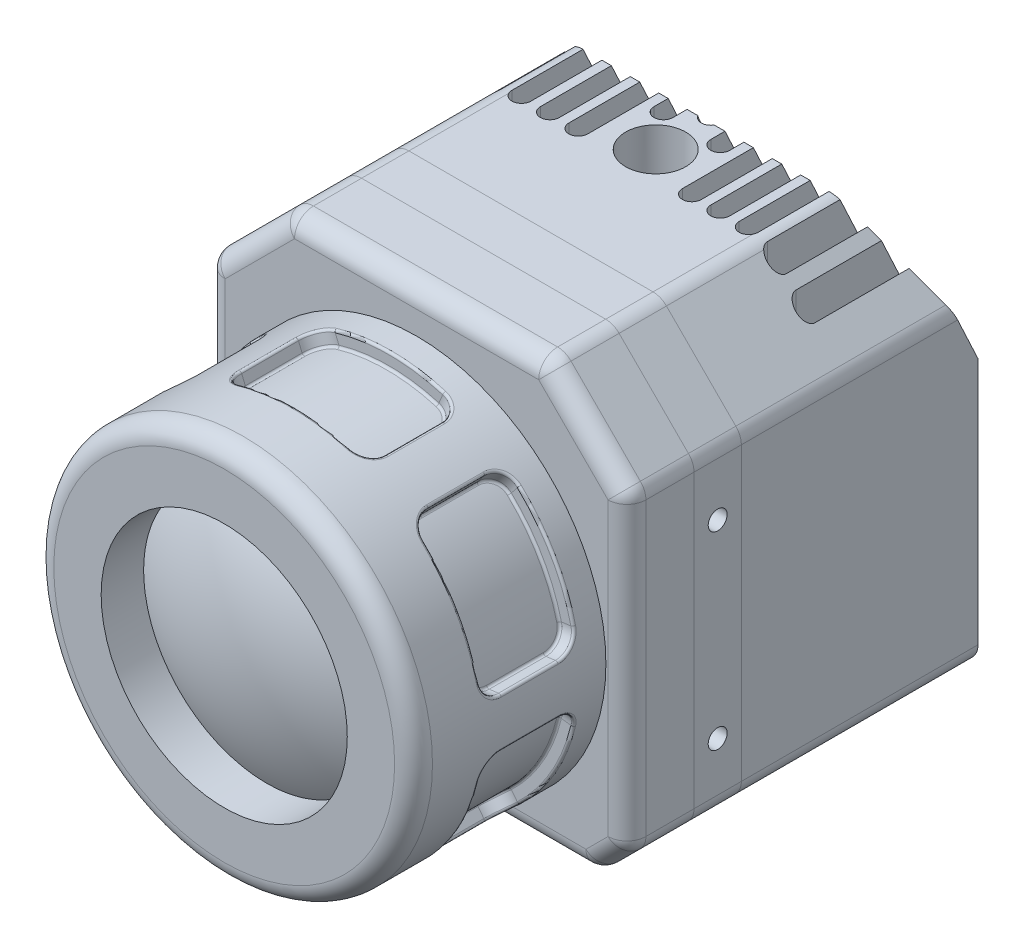
from build123d import *
from build123d.topology import SkipClean

# Parameters (mm, degrees)
BOSS_EXTRUDE1_DEPTH      = 25
BOSS_EXTRUDE2_START      = 37.084
BOSS_EXTRUDE2_DEPTH      = 20.32
BOSS_EXTRUDE3_START      = 25
BOSS_EXTRUDE3_DEPTH      = 5
BOSS_EXTRUDE4_START      = 30
BOSS_EXTRUDE4_DEPTH      = 7.08
CUT_EXTRUDE2_DEPTH       = 66.539452553
CUT_EXTRUDE5_START       = -20
SKETCH9_R                = 1
CUT_EXTRUDE5_DEPTH       = 46.539452553
FILLET1_R                = 2
FILLET3_R                = 2
FILLET7_R                = 2
FILLET8_R                = 2
SHELL4_T                 = -6.3
SHELL5_START             = 32
SHELL5_DEPTH             = 3.08
CUT_EXTRUDE4_DEPTH       = 66.539452641
CUT_EXTRUDE4_DEPTH_BACK  = 66.539452641
FILLET4_R                = 2
SKETCH7_W                = 10
SKETCH7_H                = 1.5
CUT_REVOLVE5_ANGLE       = 45
FILLET5_R                = 2
FILLET6_R                = 0.25
CIRPATTERN1_COUNT        = 6
FILLET5_OF_CIRPATTERN1_R = 2
FILLET6_OF_CIRPATTERN1_R = 0.25
SKETCH11_R               = 1
CUT_EXTRUDE6_DEPTH       = 4


# Read off the part's stored shape, not the designer's step: Shell5
with BuildPart() as part:
    # Sketch2 → Boss-Extrude1 (new body)
    with BuildSketch(Plane.XY):
        Polygon((0, 21.95), (-13.725, 21.95), (-22.225, 13.45), (-22.225, -19), (-18.725, -22.5), (0, -22.5), align=None)
    extrude(amount=BOSS_EXTRUDE1_DEPTH)

    # Sketch5 → Cut-Extrude2 (cut, through all)
    with BuildSketch(Plane(origin=(0, 0, 0), x_dir=(0, 0, -1), z_dir=(1, 0, 0))):
        Polygon((-6.504991831, 21.95), (0, 8), (0, 21.95), align=None)
    extrude(amount=-CUT_EXTRUDE2_DEPTH, mode=Mode.SUBTRACT)

    # Fillet3
    fillet3_edges = [part.edges().sort_by_distance(p)[0] for p in [
        (-18.725, -22.5, 12.5),
        (-22.225, -19, 12.5),
        (-22.225, 13.45, 13.770688368),
        (-13.725, 21.95, 15.752495916),
    ]]
    fillet(fillet3_edges, radius=FILLET3_R)

    # Shell4
    shell4_openings = [part.faces().sort_by_distance(p)[0] for p in [
        (0, -1.023133208, 12.93979886),
    ]]
    offset(amount=SHELL4_T, openings=shell4_openings, kind=Kind.INTERSECTION)

    # Sketch6 → Cut-Extrude4 (cut, two sides: drawn at the far end of the back side and taken through both)
    with BuildSketch(Plane(origin=(0, 0, 0), x_dir=(1, 0, 0), z_dir=(0, 1, 0)).offset(-CUT_EXTRUDE4_DEPTH_BACK)):
        with BuildLine():
            Line((0, -7), (0, 10))
            ThreePointArc((0, 10), (-0.707106781, 9.707106781), (-1, 9))
            Line((-1, 9), (-1, -6))
            ThreePointArc((-1, -6), (-0.707106781, -6.707106781), (0, -7))
        make_face()
        with BuildLine():
            Line((-4, -8), (-4, 9))
            ThreePointArc((-4, 9), (-3, 10), (-2, 9))
            Line((-2, 9), (-2, -8))
            ThreePointArc((-2, -8), (-3, -9), (-4, -8))
        make_face()
        with BuildLine():
            Line((-7, -14), (-7, 9))
            ThreePointArc((-7, 9), (-6, 10), (-5, 9))
            Line((-5, 9), (-5, -14))
            ThreePointArc((-5, -14), (-6, -15), (-7, -14))
        make_face()
        with BuildLine():
            Line((-10, -14), (-10, 9))
            ThreePointArc((-10, 9), (-9, 10), (-8, 9))
            Line((-8, 9), (-8, -14))
            ThreePointArc((-8, -14), (-9, -15), (-10, -14))
        make_face()
        with BuildLine():
            Line((-13, -14), (-13, 9))
            ThreePointArc((-13, 9), (-12, 10), (-11, 9))
            Line((-11, 9), (-11, -14))
            ThreePointArc((-11, -14), (-12, -15), (-13, -14))
        make_face()
        with BuildLine():
            Line((-16, -14), (-16, 9))
            ThreePointArc((-16, 9), (-15, 10), (-14, 9))
            Line((-14, 9), (-14, -14))
            ThreePointArc((-14, -14), (-15, -15), (-16, -14))
        make_face()
        with BuildLine():
            Line((-19, -14), (-19, 9))
            ThreePointArc((-19, 9), (-18, 10), (-17, 9))
            Line((-17, 9), (-17, -14))
            ThreePointArc((-17, -14), (-18, -15), (-19, -14))
        make_face()
        with BuildLine():
            Line((0, -15), (0, -8.65))
            ThreePointArc((0, -8.65), (-3.175, -11.825), (0, -15))
        make_face()
    extrude(amount=CUT_EXTRUDE4_DEPTH + CUT_EXTRUDE4_DEPTH_BACK, mode=Mode.SUBTRACT)

    # Mirror1: part across plane


with BuildPart() as body_2:
    # Sketch2<3> → Boss-Extrude2 (new body)
    with BuildSketch(Plane.XY.offset(BOSS_EXTRUDE2_START)):
        with BuildLine():
            Line((0, 10.5), (0, 17.5))
            ThreePointArc((0, 17.5), (-20, -2.5), (0, -22.5))
            Line((0, -22.5), (0, -15.5))
            ThreePointArc((0, -15.5), (-13, -2.5), (0, 10.5))
        make_face()
    extrude(amount=BOSS_EXTRUDE2_DEPTH)

    # Fillet1
    fillet1_edges = [body_2.edges().sort_by_distance(p)[0] for p in [
        (-20, -2.5, 57.404),
    ]]
    fillet(fillet1_edges, radius=FILLET1_R)

    # Mirror1 4: body 2 across plane


with BuildPart() as body_3:
    # Sketch2<4> → Boss-Extrude3 (new body)
    with BuildSketch(Plane.XY.offset(BOSS_EXTRUDE3_START)):
        Polygon((0, 21.95), (-13.725, 21.95), (-22.225, 13.45), (-22.225, -19), (-18.725, -22.5), (0, -22.5), align=None)
    extrude(amount=BOSS_EXTRUDE3_DEPTH)

    # Sketch9 → Cut-Extrude5 (cut, through all)
    with BuildSketch(Plane(origin=(0, 0, 0), x_dir=(0, 0, -1), z_dir=(1, 0, 0)).offset(CUT_EXTRUDE5_START)):
        with Locations((-27.5, 7)):
            Circle(SKETCH9_R)
        with Locations((-27.5, -13)):
            Circle(SKETCH9_R)
    extrude(amount=-CUT_EXTRUDE5_DEPTH, mode=Mode.SUBTRACT)

    # Fillet7
    fillet7_edges = [body_3.edges().sort_by_distance(p)[0] for p in [
        (-18.725, -22.5, 27.5),
        (-22.225, -19, 27.5),
        (-22.225, 13.45, 27.5),
        (-13.725, 21.95, 27.5),
    ]]
    fillet(fillet7_edges, radius=FILLET7_R)

    # Mirror1 2: body 3 across plane


with BuildPart() as body_4:
    # Sketch2<5> → Boss-Extrude4 (new body)
    with BuildSketch(Plane.XY.offset(BOSS_EXTRUDE4_START)):
        Polygon((0, 21.95), (-13.725, 21.95), (-22.225, 13.45), (-22.225, -19), (-18.725, -22.5), (0, -22.5), align=None)
    extrude(amount=BOSS_EXTRUDE4_DEPTH)

    # Fillet8
    fillet8_edges = [body_4.edges().sort_by_distance(p)[0] for p in [
        (-18.725, -22.5, 33.54),
        (-22.225, -19, 33.54),
        (-22.225, 13.45, 33.54),
        (-13.725, 21.95, 33.54),
    ]]
    fillet(fillet8_edges, radius=FILLET8_R)

    # Shell5 outline → Shell5 (cut)
    with BuildSketch(Plane.XY.offset(SHELL5_START)):
        Polygon((-20.225, -18.171572875), (-17.896572875, -20.5), (0, -20.5), (0, 19.95), (-12.896572875, 19.95), (-20.225, 12.621572875), align=None)
    extrude(amount=SHELL5_DEPTH, mode=Mode.SUBTRACT)

    # Mirror1 3: body 4 across plane


with BuildPart() as part_1:
    add(part.part)
    add(part.part.mirror(Plane(origin=(0, 0, 0), x_dir=(0, 0, 1), z_dir=(1, 0, 0))))


with BuildPart() as body_3_1:
    add(body_3.part)
    add(body_3.part.mirror(Plane(origin=(0, 0, 0), x_dir=(0, 0, 1), z_dir=(1, 0, 0))))

    # Sketch11 → Cut-Extrude6 (cut)
    with BuildSketch(Plane.XZ.offset(22.5)):
        with Locations((-15, 27.5)):
            Circle(SKETCH11_R)
        with Locations((15, 27.5)):
            Circle(SKETCH11_R)
    extrude(amount=-CUT_EXTRUDE6_DEPTH, mode=Mode.SUBTRACT)


with BuildPart() as body_4_1:
    add(body_4.part)
    add(body_4.part.mirror(Plane(origin=(0, 0, 0), x_dir=(0, 0, 1), z_dir=(1, 0, 0))))

    # Fillet4
    fillet4_edges = [body_4_1.edges().sort_by_distance(p)[0] for p in [
        (-20.475, -20.75, 37.08),
        (0, 21.95, 37.08),
        (-17.975, 17.7, 37.08),
        (-22.225, -2.775, 37.08),
        (-13.66193974, 21.797759065, 37.08),
        (-22.072759065, 13.38693974, 37.08),
        (-22.072759065, -18.93693974, 37.08),
        (-18.66193974, -22.347759065, 37.08),
        (0, -22.5, 37.08),
        (20.475, -20.75, 37.08),
        (22.225, -2.775, 37.08),
        (17.975, 17.7, 37.08),
        (18.66193974, -22.347759065, 37.08),
        (22.072759065, -18.93693974, 37.08),
        (22.072759065, 13.38693974, 37.08),
        (13.66193974, 21.797759065, 37.08),
    ]]
    fillet(fillet4_edges, radius=FILLET4_R)


with BuildPart() as body_2_1:
    with SkipClean():  # the faces are left unmerged after this step: merging them gives an invalid solid
        add(body_2.part)
        add(body_2.part.mirror(Plane(origin=(0, 0, 0), x_dir=(0, 0, 1), z_dir=(1, 0, 0))))

    # Sketch7 → Cut-Revolve5 (revolve, symmetric, cut)
    with SkipClean():  # the faces are left unmerged after this step: merging them gives an invalid solid
        with BuildSketch(Plane(origin=(0, 0, 0), x_dir=(0, 0, -1), z_dir=(1, 0, 0))) as cut_revolve5_sk:
            with Locations((-45, 16.75)):
                Rectangle(SKETCH7_W, SKETCH7_H)
        cut_revolve5 = revolve(axis=Axis((0, -2.5, 57.404), (0, 0, -1)), revolution_arc=CUT_REVOLVE5_ANGLE / 2, mode=Mode.SUBTRACT)
        cut_revolve5 = cut_revolve5 + revolve(cut_revolve5_sk.sketch, axis=Axis((0, -2.5, 57.404), (0, 0, 1)), revolution_arc=CUT_REVOLVE5_ANGLE / 2, mode=Mode.SUBTRACT)

    # Fillet5
    fillet5_edges = [body_2_1.edges().sort_by_distance(p)[0] for p in [
        (-7.366656073, 15.284681001, 50),
        (-7.366656073, 15.284681001, 40),
        (7.366656073, 15.284681001, 50),
        (7.366656073, 15.284681001, 40),
    ]]
    fillet(fillet5_edges, radius=FILLET5_R)

    # Fillet6
    fillet6_edges = [body_2_1.edges().sort_by_distance(p)[0] for p in [
        (-7.079643499, 14.591771351, 45),
        (-7.653668647, 15.97759065, 45),
        (0, 16, 40),
        (0, 16, 50),
        (7.079643499, 14.591771351, 45),
        (6.533711816, 14.807819328, 40.58452092),
        (6.533711816, 14.807819328, 49.41547908),
        (-6.53371182, 14.807819327, 40.58452092),
        (-6.533711816, 14.807819328, 49.41547908),
        (2.914897203, 17.286444205, 50),
        (-2.914897203, 17.286444205, 40),
        (7.653668647, 15.97759065, 45),
        (-7.108176358, 16.194219129, 49.415295587),
        (-7.108176358, 16.19421913, 40.584704412),
        (7.108176358, 16.194219129, 49.415295587),
        (7.108176358, 16.194219129, 40.584704413),
    ]]
    fillet(fillet6_edges, radius=FILLET6_R)

    # CirPattern1: Cut-Revolve5 ×6 about axis
    with SkipClean():  # the faces are left unmerged after this step: merging them gives an invalid solid
        cirpattern1_axis = Axis((0, -2.5, 57.404), (0, 0, -1))
        for i in range(1, CIRPATTERN1_COUNT):
            add(cut_revolve5.rotate(cirpattern1_axis, i * 360 / CIRPATTERN1_COUNT), mode=Mode.SUBTRACT)

    # Fillet5 of CirPattern1
    fillet5_of_cirpattern1_edges = [body_2_1.edges().sort_by_distance(p)[0] for p in [
        (11.718657508, 12.772051801, 50),
        (11.718657508, 12.772051801, 40),
        (19.085313581, 0.0126292, 50),
        (19.085313581, 0.0126292, 40),
        (19.085313581, -5.0126292, 50),
        (19.085313581, -5.0126292, 40),
        (11.718657508, -17.772051801, 50),
        (11.718657508, -17.772051801, 40),
        (7.366656073, -20.284681001, 50),
        (7.366656073, -20.284681001, 40),
        (-7.366656073, -20.284681001, 50),
        (-7.366656073, -20.284681001, 40),
        (-11.718657508, -17.772051801, 50),
        (-11.718657508, -17.772051801, 40),
        (-19.085313581, -5.0126292, 50),
        (-19.085313581, -5.0126292, 40),
        (-19.085313581, 0.0126292, 50),
        (-19.085313581, 0.0126292, 40),
        (-11.718657508, 12.772051801, 50),
        (-11.718657508, 12.772051801, 40),
    ]]
    fillet(fillet5_of_cirpattern1_edges, radius=FILLET5_OF_CIRPATTERN1_R)

    # Fillet6 of CirPattern1
    fillet6_of_cirpattern1_edges = [body_2_1.edges().sort_by_distance(p)[0] for p in [
        (11.262086437, 12.177036795, 45),
        (12.17522858, 13.367066806, 45),
        (16.02146997, 6.75, 40),
        (16.02146997, 6.75, 50),
        (18.341729935, -0.085265444, 45),
        (18.255867131, 0.49554925, 40.58452092),
        (18.255867131, 0.49554925, 49.41547908),
        (11.722155312, 11.812270081, 40.58452092),
        (11.722155314, 11.812270078, 49.41547908),
        (18.593011934, 4.868847076, 50),
        (15.678114731, 9.91759713, 40),
        (19.828897227, 0.110523844, 45),
        (12.635580491, 13.002970866, 49.415295587),
        (12.635580491, 13.002970865, 40.584704412),
        (19.743756849, 0.691248264, 49.415295587),
        (19.743756849, 0.691248264, 40.584704413),
        (18.341729935, -4.914734556, 45),
        (19.828897227, -5.110523844, 45),
        (16.02146997, -11.75, 40),
        (16.02146997, -11.75, 50),
        (11.262086437, -17.177036795, 45),
        (11.722155314, -16.812270078, 40.58452092),
        (11.722155314, -16.812270078, 49.41547908),
        (18.255867131, -5.495549247, 40.58452092),
        (18.255867131, -5.49554925, 49.41547908),
        (15.678114731, -14.91759713, 50),
        (18.593011934, -9.868847076, 40),
        (12.17522858, -18.367066806, 45),
        (19.743756849, -5.691248264, 49.415295587),
        (19.743756849, -5.691248264, 40.584704412),
        (12.635580491, -18.002970866, 49.415295587),
        (12.635580491, -18.002970866, 40.584704413),
        (7.079643499, -19.591771351, 45),
        (7.653668647, -20.97759065, 45),
        (0, -21, 40),
        (0, -21, 50),
        (-7.079643499, -19.591771351, 45),
        (-6.533711816, -19.807819328, 40.58452092),
        (-6.533711816, -19.807819328, 49.41547908),
        (6.53371182, -19.807819327, 40.58452092),
        (6.533711816, -19.807819328, 49.41547908),
        (-2.914897203, -22.286444205, 50),
        (2.914897203, -22.286444205, 40),
        (-7.653668647, -20.97759065, 45),
        (7.108176358, -21.194219129, 49.415295587),
        (7.108176358, -21.19421913, 40.584704412),
        (-7.108176358, -21.194219129, 49.415295587),
        (-7.108176358, -21.194219129, 40.584704413),
        (-11.262086437, -17.177036795, 45),
        (-12.17522858, -18.367066806, 45),
        (-16.02146997, -11.75, 40),
        (-16.02146997, -11.75, 50),
        (-18.341729935, -4.914734556, 45),
        (-18.255867131, -5.49554925, 40.58452092),
        (-18.255867131, -5.49554925, 49.41547908),
        (-11.722155312, -16.812270081, 40.58452092),
        (-11.722155314, -16.812270078, 49.41547908),
        (-18.593011934, -9.868847076, 50),
        (-15.678114731, -14.91759713, 40),
        (-19.828897227, -5.110523844, 45),
        (-12.635580491, -18.002970866, 49.415295587),
        (-12.635580491, -18.002970865, 40.584704412),
        (-19.743756849, -5.691248264, 49.415295587),
        (-19.743756849, -5.691248264, 40.584704413),
        (-18.341729935, -0.085265444, 45),
        (-19.828897227, 0.110523844, 45),
        (-16.02146997, 6.75, 40),
        (-16.02146997, 6.75, 50),
        (-11.262086437, 12.177036795, 45),
        (-11.722155314, 11.812270078, 40.58452092),
        (-11.722155314, 11.812270078, 49.41547908),
        (-18.255867131, 0.495549247, 40.58452092),
        (-18.255867131, 0.49554925, 49.41547908),
        (-15.678114731, 9.91759713, 50),
        (-18.593011934, 4.868847076, 40),
        (-12.17522858, 13.367066806, 45),
        (-19.743756849, 0.691248264, 49.415295587),
        (-19.743756849, 0.691248264, 40.584704412),
        (-12.635580491, 13.002970866, 49.415295587),
        (-12.635580491, 13.002970866, 40.584704413),
    ]]
    fillet(fillet6_of_cirpattern1_edges, radius=FILLET6_OF_CIRPATTERN1_R)


with BuildPart() as body_5:
    # Sketch3 → Revolve1 (revolve)
    with BuildSketch(Plane(origin=(0, 0, 0), x_dir=(0, 0, -1), z_dir=(1, 0, 0)), mode=Mode.PRIVATE) as revolve1_sk:
        with BuildLine():
            ThreePointArc((-56.404, -2.5), (-55.518071484, 4.229295173), (-52.920660498, 10.5))
            Line((-52.920660498, 10.5), (-52.920660498, -2.5))
            Line((-52.920660498, -2.5), (-56.404, -2.5))
        make_face()
    revolve(revolve1_sk.sketch.rotate(Axis((0, -2.5, 0), (0, 0, 1)), 270), axis=Axis((0, -2.5, 0), (0, 0, 1)))


solid = Compound([part_1.part, body_3_1.part, body_4_1.part, body_2_1.part, body_5.part])
